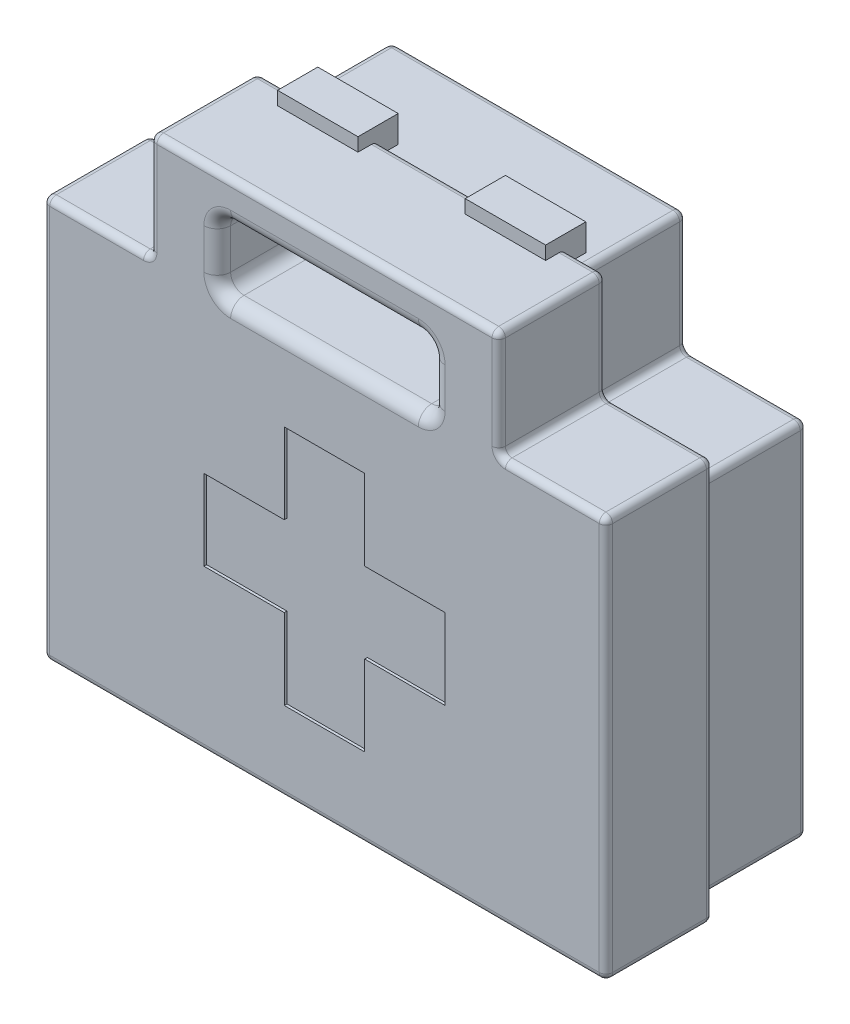
from build123d import *

# Parameters (mm, degrees)
SKETCH1_W           = 200
SKETCH1_H           = 180
BOSS_EXTRUDE1_DEPTH = 40
SKETCH2_W           = 80
SKETCH2_H           = 25
CUT_EXTRUDE1_DEPTH  = 273.029410175
SKETCH3_W           = 210
SKETCH3_H           = 190
BOSS_EXTRUDE2_DEPTH = 40
SKETCH2_2_W         = 80
SKETCH2_2_H         = 25
CUT_EXTRUDE2_DEPTH  = 280.016128566
SKETCH4_W           = 30
SKETCH4_H           = 15
BOSS_EXTRUDE3_DEPTH = 10
SKETCH5_W           = 40
SKETCH5_H           = 40
CUT_EXTRUDE3_DEPTH  = 40
SKETCH6_W           = 45
SKETCH6_H           = 45
CUT_EXTRUDE4_DEPTH  = 40
FILLET1_R           = 5
FILLET2_R           = 2.5
SKETCH7_W           = 30
SKETCH7_H           = 30
CUT_EXTRUDE5_DEPTH  = 1


with BuildPart() as part:
    # Sketch1 → Boss-Extrude1 (new body)
    with BuildSketch(Plane.XY):
        with Locations((100, 90)):
            Rectangle(SKETCH1_W, SKETCH1_H)
    extrude(amount=BOSS_EXTRUDE1_DEPTH)

    # Sketch2 → Cut-Extrude1 (cut, through all)
    with BuildSketch(Plane.XY.offset(40)):
        with Locations((100, 157.5)):
            Rectangle(SKETCH2_W, SKETCH2_H)
    extrude(amount=-CUT_EXTRUDE1_DEPTH, mode=Mode.SUBTRACT)

    # Sketch3 → Boss-Extrude2 (add)
    with BuildSketch(Plane.XY.offset(40)):
        with Locations((100, 90)):
            Rectangle(SKETCH3_W, SKETCH3_H)
    extrude(amount=BOSS_EXTRUDE2_DEPTH)

    # Sketch2<2> → Cut-Extrude2 (cut, through all)
    with BuildSketch(Plane.XY.offset(40)):
        with Locations((100, 157.5)):
            Rectangle(SKETCH2_2_W, SKETCH2_2_H)
    extrude(amount=CUT_EXTRUDE2_DEPTH, mode=Mode.SUBTRACT)

    # Sketch4 → Boss-Extrude3 (add)
    with BuildSketch(Plane(origin=(0, 180, 0), x_dir=(1, 0, 0), z_dir=(0, 1, 0))):
        with Locations((135, -40)):
            Rectangle(SKETCH4_W, SKETCH4_H)
        with Locations((65, -40)):
            Rectangle(SKETCH4_W, SKETCH4_H)
    extrude(amount=BOSS_EXTRUDE3_DEPTH)

    # Sketch5 → Cut-Extrude3 (cut)
    with BuildSketch(Plane.XY.offset(80)):
        with Locations((185, 165)):
            Rectangle(SKETCH5_W, SKETCH5_H)
        with Locations((15, 165)):
            Rectangle(SKETCH5_W, SKETCH5_H)
    extrude(amount=-CUT_EXTRUDE3_DEPTH, mode=Mode.SUBTRACT)

    # Sketch6 → Cut-Extrude4 (cut)
    with BuildSketch(Plane(origin=(0, 0, 0), x_dir=(-1, 0, 0), z_dir=(0, 0, -1))):
        with Locations((-177.5, 157.5)):
            Rectangle(SKETCH6_W, SKETCH6_H)
        with Locations((-22.5, 157.5)):
            Rectangle(SKETCH6_W, SKETCH6_H)
    extrude(amount=-CUT_EXTRUDE4_DEPTH, mode=Mode.SUBTRACT)

    # Fillet1
    fillet1_edges = [part.edges().sort_by_distance(p)[0] for p in [
        (140, 157.5, 0),
        (140, 170, 40),
        (100, 145, 0),
        (140, 145, 40),
        (60, 157.5, 0),
        (60, 145, 40),
        (100, 170, 0),
        (60, 170, 40),
        (140, 157.5, 80),
        (100, 170, 80),
        (60, 157.5, 80),
        (100, 145, 80),
    ]]
    fillet(fillet1_edges, radius=FILLET1_R)

    # Fillet2
    fillet2_edges = [part.edges().sort_by_distance(p)[0] for p in [
        (0, 0, 20),
        (200, 0, 20),
        (0, 67.5, 0),
        (100, 0, 0),
        (200, 67.5, 0),
        (100, 180, 0),
        (-5, -5, 60),
        (205, -5, 60),
        (205, 70, 80),
        (100, -5, 80),
        (-5, 70, 80),
        (100, 185, 80),
        (100, 180, 40),
        (100, 185, 40),
        (205, 145, 60),
        (185, 145, 80),
        (165, 185, 60),
        (165, 145, 60),
        (165, 165, 80),
        (35, 185, 60),
        (35, 165, 80),
        (-5, 145, 60),
        (35, 145, 60),
        (15, 145, 80),
        (200, 67.5, 40),
        (100, 0, 40),
        (0, 67.5, 40),
        (42.5, 185, 40),
        (35, 165, 40),
        (15, 145, 40),
        (-5, 70, 40),
        (100, -5, 40),
        (205, 70, 40),
        (185, 145, 40),
        (165, 165, 40),
        (157.5, 185, 40),
        (155, 157.5, 0),
        (155, 157.5, 40),
        (155, 180, 20),
        (200, 135, 20),
        (177.5, 135, 0),
        (177.5, 135, 40),
        (155, 135, 20),
        (22.5, 135, 0),
        (22.5, 135, 40),
        (0, 135, 20),
        (45, 180, 20),
        (45, 157.5, 0),
        (45, 157.5, 40),
        (45, 135, 20),
        (152.5, 180, 40),
        (47.5, 180, 40),
    ]]
    fillet(fillet2_edges, radius=FILLET2_R - 0.0001)  # a hair under: the kernel refuses the full size

    # Sketch7 → Cut-Extrude5 (cut)
    with BuildSketch(Plane.XY.offset(80)):
        with Locations((100, 70)):
            Rectangle(SKETCH7_W, SKETCH7_H)
        with Locations((130, 70)):
            Rectangle(SKETCH7_W, SKETCH7_H)
        with Locations((100, 40)):
            Rectangle(SKETCH7_W, SKETCH7_H)
        with Locations((70, 70)):
            Rectangle(SKETCH7_W, SKETCH7_H)
        with Locations((100, 100)):
            Rectangle(SKETCH7_W, SKETCH7_H)
    extrude(amount=-CUT_EXTRUDE5_DEPTH, mode=Mode.SUBTRACT)


solid = part.part
